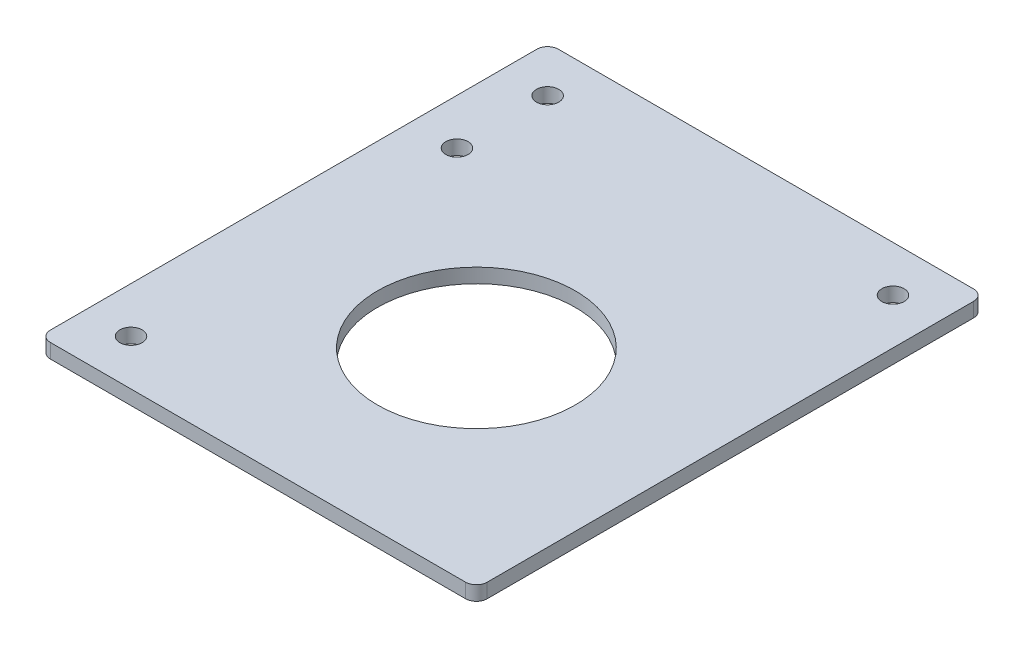
from build123d import *

# Parameters (mm, degrees)
SKETCH1_W           = 121.4
SKETCH1_H           = 141.2
SKETCH1_R           = 27.5
SKETCH1_R_2         = 3.1
BOSS_EXTRUDE1_DEPTH = 4
FILLET1_R           = 3


with BuildPart() as part:
    # Sketch1 → Boss-Extrude1 (new body)
    with BuildSketch(Plane(origin=(0, 0, 0), x_dir=(1, 0, 0), z_dir=(0, 1, 0))):
        with Locations((61.417527055, -45.2)):
            Rectangle(SKETCH1_W, SKETCH1_H)
        with Locations((64.217527055, -57.9)):
            Circle(SKETCH1_R, mode=Mode.SUBTRACT)
        with Locations((13.417527055, 12.7)):
            Circle(SKETCH1_R_2, mode=Mode.SUBTRACT)
        with Locations((109.417527055, 12.7)):
            Circle(SKETCH1_R_2, mode=Mode.SUBTRACT)
        with Locations((13.417527055, -103.1)):
            Circle(SKETCH1_R_2, mode=Mode.SUBTRACT)
        with Locations((13.417527055, -12.5)):
            Circle(SKETCH1_R_2, mode=Mode.SUBTRACT)
    extrude(amount=BOSS_EXTRUDE1_DEPTH)

    # Fillet1
    fillet1_edges = [part.edges().sort_by_distance(p)[0] for p in [
        (122.117527055, 2, -25.4),
        (122.117527055, 2, 115.8),
        (0.717527055, 2, 115.8),
        (0.717527055, 2, -25.4),
    ]]
    fillet(fillet1_edges, radius=FILLET1_R)


solid = part.part
